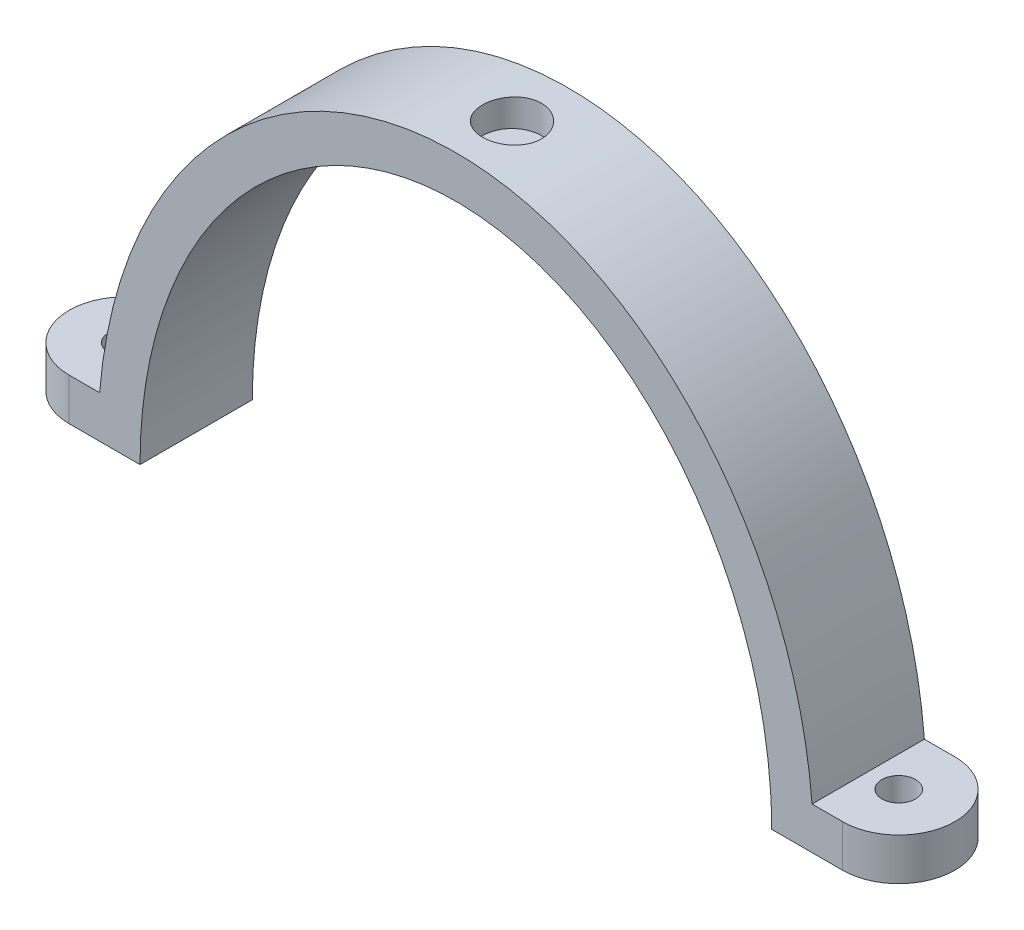
from build123d import *

# Parameters (mm, degrees)
SKETCH1_R             = 1
BOSS_EXTRUDE1_DEPTH   = 3
BOSS_EXTRUDE1_2_DEPTH = 3
BOSS_EXTRUDE2_DEPTH   = 4
SKETCH4_R             = 2.1
CUT_EXTRUDE1_DEPTH    = 2
M2_CLEARANCE_HOLE1_D  = 2.4


with BuildPart() as part:
    # Sketch1 → Boss-Extrude1 (new body)
    with BuildSketch(Plane(origin=(0, 0, 0), x_dir=(1, 0, 0), z_dir=(0, 1, 0))):
        with BuildLine():
            Line((0, -4), (5, -4))
            Line((5, -4), (5, 4))
            Line((5, 4), (0, 4))
            ThreePointArc((0, 4), (-4, 0), (0, -4))
        make_face()
        Circle(SKETCH1_R, mode=Mode.SUBTRACT)
    extrude(amount=BOSS_EXTRUDE1_DEPTH)



with BuildPart() as body_2:
    # Sketch1 → Boss-Extrude1 2 (new body)
    with BuildSketch(Plane(origin=(0, 0, 0), x_dir=(1, 0, 0), z_dir=(0, 1, 0))):
        with BuildLine():
            Line((55.1, -4), (50.1, -4))
            Line((50.1, -4), (50.1, 4))
            Line((50.1, 4), (55.1, 4))
            ThreePointArc((55.1, 4), (59.1, 0), (55.1, -4))
        make_face()
        with Locations((55.1, 0)):
            Circle(SKETCH1_R, mode=Mode.SUBTRACT)
    extrude(amount=BOSS_EXTRUDE1_2_DEPTH)


with BuildPart() as part_1:
    add(part.part)

    add(body_2.part)  # Boss-Extrude2 merges body 2
    # Sketch2 → Boss-Extrude2 (add, symmetric)
    with BuildSketch(Plane.XY):
        with BuildLine():
            Line((2.05, 0), (5.05, 0))
            add(Edge.make_bspline(
                [(50.05, 0), (50.05, 27.5), (27.55, 27.5), (5.05, 27.5), (5.05, 0)],
                knots=[4.71238898, 4.71238898, 4.71238898, 6.283185307, 6.283185307, 7.853981634, 7.853981634, 7.853981634], degree=2, weights=[1, 0.707106781, 1, 0.707106781, 1]))
            Line((50.05, 0), (53.05, 0))
            add(Edge.make_bspline(
                [(53.05, 0), (53.05, 30.5), (27.55, 30.5), (2.05, 30.5), (2.05, 0)],
                knots=[4.71238898, 4.71238898, 4.71238898, 6.283185307, 6.283185307, 7.853981634, 7.853981634, 7.853981634], degree=2, weights=[1, 0.707106781, 1, 0.707106781, 1]))
        make_face()
    extrude(amount=BOSS_EXTRUDE2_DEPTH, both=True)

    # Sketch4 → Cut-Extrude1 (cut)
    with BuildSketch(Plane(origin=(0, 30.5, 0), x_dir=(1, 0, 0), z_dir=(0, 1, 0))):
        with Locations((27.55, 0)):
            Circle(SKETCH4_R)
    extrude(amount=-CUT_EXTRUDE1_DEPTH, mode=Mode.SUBTRACT)

    # M2 Clearance Hole1 (through all)
    with Locations(Plane(origin=(0, 3, 0), x_dir=(1, 0, 0), z_dir=(0, 1, 0))):
        with Locations((0, 0), (55.1, 0)):
            Hole(M2_CLEARANCE_HOLE1_D / 2)


solid = part_1.part
